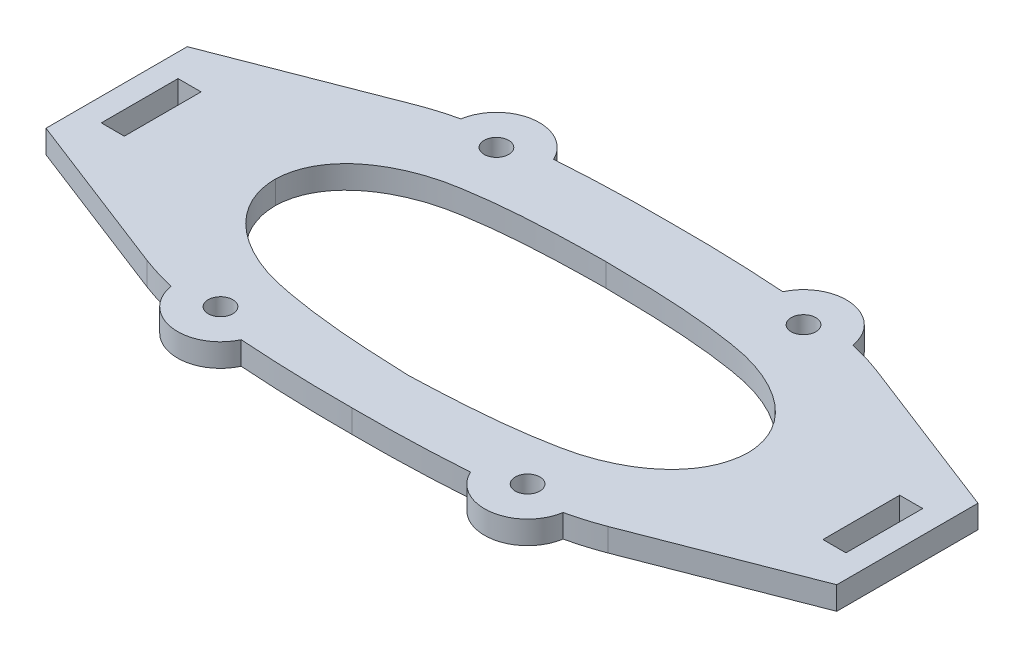
from build123d import *

# Parameters (mm, degrees)
ESBO_O1_R                = 1.6
ESBO_O1_R_2              = 1.600000007
ESBO_O1_W                = 3
ESBO_O1_H                = 10
RESSALTO_EXTRUS_O1_DEPTH = 3


with BuildPart() as part:
    # Esboço1 → Ressalto-extrusão1 (new body)
    with BuildSketch(Plane.XZ.offset(-10)):
        with BuildLine():
            Line((51.499999993, -9.199919627), (30.012815024, -17.523454587))
            ThreePointArc((30.012815024, -17.523454587), (27.794530711, -18.278912218), (25.52729552, -18.871488049))
            ThreePointArc((25.52729552, -18.871488049), (20.770943353, -23.518767255), (14.927492503, -20.344783619))
            ThreePointArc((14.927492503, -20.344783619), (7.468243271, -20.722523982), (-3e-09, -20.814335031))
            ThreePointArc((-3e-09, -20.814335031), (-7.468243278, -20.722523982), (-14.92749251, -20.344783619))
            ThreePointArc((-14.92749251, -20.344783619), (-20.77094336, -23.518767255), (-25.527295527, -18.871488049))
            ThreePointArc((-25.527295527, -18.871488049), (-27.794530718, -18.278912218), (-30.012815031, -17.523454587))
            Line((-30.012815031, -17.523454587), (-51.5, -9.199919627))
            Line((-51.5, -9.199919627), (-51.5, 9.199919627))
            Line((-51.5, 9.199919627), (-30.012813463, 17.523455055))
            ThreePointArc((-30.012813463, 17.523455055), (-27.794297688, 18.278162584), (-25.527295582, 18.871540329))
            ThreePointArc((-25.527295582, 18.871540329), (-20.770915167, 23.518776829), (-14.927486351, 20.344772827))
            ThreePointArc((-14.927486351, 20.344772827), (-7.468162157, 20.720034772), (-3e-09, 20.814337605))
            ThreePointArc((-3e-09, 20.814337605), (7.46816215, 20.720034772), (14.927486344, 20.344772827))
            ThreePointArc((14.927486344, 20.344772827), (20.77091516, 23.518776829), (25.527295575, 18.871540329))
            ThreePointArc((25.527295575, 18.871540329), (27.794297681, 18.278162584), (30.012813456, 17.523455055))
            Line((30.012813456, 17.523455055), (51.499999993, 9.199919627))
            Line((51.499999993, 9.199919627), (51.499999993, -9.199919627))
        make_face()
        with Locations((-19.999996013, -17.972093401)):
            Circle(ESBO_O1_R, mode=Mode.SUBTRACT)
        with Locations((-20.000000042, 17.972094091)):
            Circle(ESBO_O1_R_2, mode=Mode.SUBTRACT)
        with Locations((20.000000035, 17.972094091)):
            Circle(ESBO_O1_R_2, mode=Mode.SUBTRACT)
        with Locations((19.999996006, -17.972093401)):
            Circle(ESBO_O1_R, mode=Mode.SUBTRACT)
        with Locations((-47, 0)):
            Rectangle(ESBO_O1_W, ESBO_O1_H, mode=Mode.SUBTRACT)
        with Locations((46.999999993, 0)):
            Rectangle(ESBO_O1_W, ESBO_O1_H, mode=Mode.SUBTRACT)
        with BuildLine():
            add(Edge.make_bspline(
                [(0, 13.48175396), (-6.225840887, 13.243866192), (-12.481673421, 12.925170728), (-24.656030895, 10.319444852), (-30.737996444, 6.272836714), (-30.833333333, 0)],
                knots=[0, 0, 0, 0, 0.5, 0.5, 1, 1, 1, 1], degree=3))
            add(Edge.make_bspline(
                [(-30.833333333, 0), (-30.664662625, -6.169349261), (-24.406493372, -9.849880174), (-12.309360845, -12.002886564), (-6.143049468, -12.144365954), (-7e-09, -12.225)],
                knots=[0, 0, 0, 0, 0.5, 0.5, 1, 1, 1, 1], degree=3))
            add(Edge.make_bspline(
                [(30.833333326, 0), (30.664662618, -6.169349261), (24.406493365, -9.849880174), (12.309360838, -12.002886564), (6.143049461, -12.144365954), (-7e-09, -12.225)],
                knots=[0, 0, 0, 0, 0.5, 0.5, 1, 1, 1, 1], degree=3))
            add(Edge.make_bspline(
                [(0, 13.48175396), (6.22584088, 13.243866192), (12.481673414, 12.925170728), (24.656030889, 10.319444852), (30.737996437, 6.272836714), (30.833333326, 0)],
                knots=[0, 0, 0, 0, 0.5, 0.5, 1, 1, 1, 1], degree=3))
        make_face(mode=Mode.SUBTRACT)
    extrude(amount=-RESSALTO_EXTRUS_O1_DEPTH)


solid = part.part
